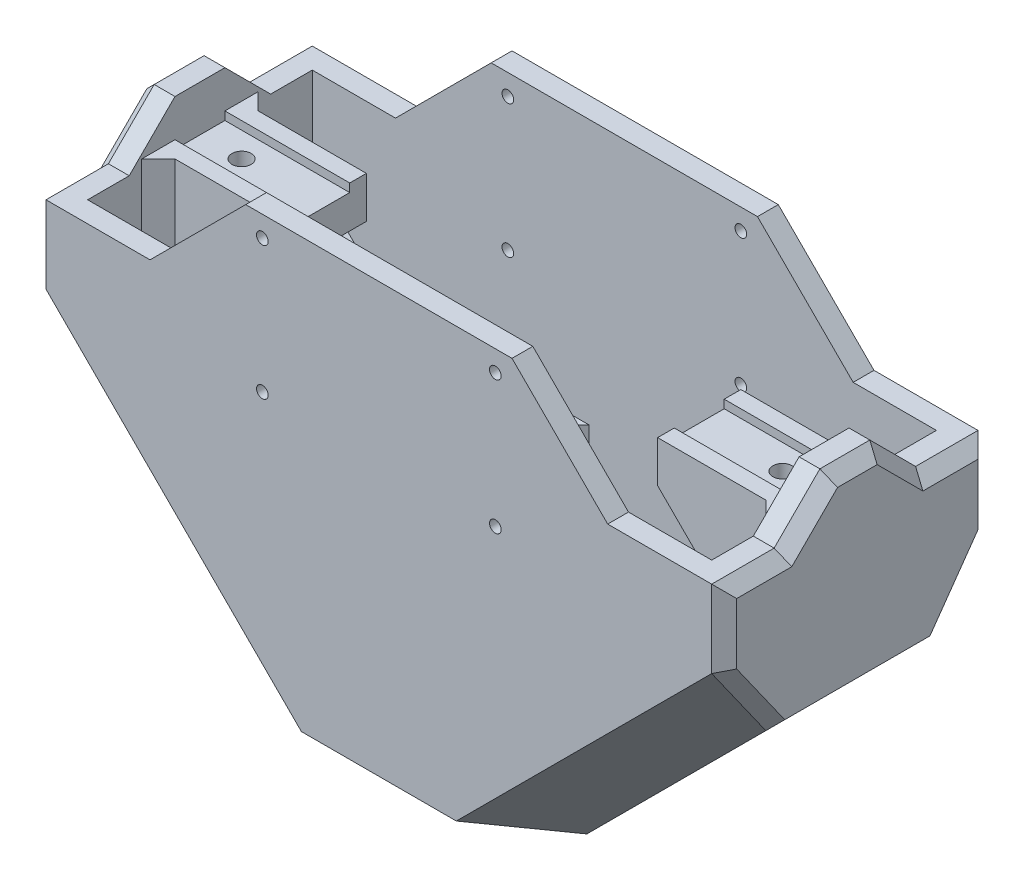
from build123d import *

# Parameters (mm, degrees)
SKETCH1_W                  = 150
SKETCH1_H                  = 54
BOSS_EXTRUDE1_DEPTH        = 75
SHELL1_T                   = 5
BOSS_EXTRUDE2_DEPTH        = 5
BOSS_EXTRUDE3_DEPTH        = 5
SKETCH3_R                  = 1.4
CUT_EXTRUDE1_DEPTH         = 6
BOSS_EXTRUDE4_DEPTH        = 10
SKETCH9_W                  = 30
SKETCH9_H                  = 20
BOSS_EXTRUDE6_DEPTH        = 2
CUT_EXTRUDE2_REACH         = 188.153
SKETCH10_W                 = 12
SKETCH10_H                 = 2
SKETCH11_R                 = 2.3
CUT_EXTRUDE3_DEPTH         = 6
SKETCH13_W                 = 10.5
SKETCH13_H                 = 15
BOSS_EXTRUDE8_DEPTH        = 27
BOSS_EXTRUDE9_DEPTH        = 3.2
CUT_EXTRUDE4_REACH         = 111.024
SKETCH15_R                 = 1.4
CHAMFER8_SIZE              = 0.5
CHAMFER8_OF_MIRROR6_SIZE   = 0.5
CHAMFER3_SIZE              = 40
CHAMFER5_SIZE              = 43
CHAMFER9_SIZE              = 5
CHAMFER10_SIZE             = 2
CHAMFER11_SIZE             = 10
CHAMFER12_SIZE             = 13
CHAMFER13_SIZE             = 4
BOSS_EXTRUDE10_DEPTH       = 3
CHAMFER14_SIZE             = 3
CHAMFER14_OF_MIRROR28_SIZE = 3


# Some blends are built 0.0001 mm under size
with BuildPart() as part:
    # Sketch1 → Boss-Extrude1 (new body)
    with BuildSketch(Plane(origin=(0, 0, 0), x_dir=(1, 0, 0), z_dir=(0, 1, 0))):
        Rectangle(SKETCH1_W, SKETCH1_H)
    extrude(amount=BOSS_EXTRUDE1_DEPTH)

    # Shell1
    shell1_openings = [part.faces().sort_by_distance(p)[0] for p in [
        (0, 75, 0),
    ]]
    offset(amount=SHELL1_T, openings=shell1_openings, kind=Kind.INTERSECTION)

    # Sketch2 → Boss-Extrude2 (add)
    with BuildSketch(Plane(origin=(80, 0, 0), x_dir=(0, 0, -1), z_dir=(1, 0, 0))):
        Polygon((-17, 75), (-6, 86), (6, 86), (17, 75), align=None)
    boss_extrude2 = extrude(amount=-BOSS_EXTRUDE2_DEPTH)

    # Sketch4 → Boss-Extrude3 (add)
    with BuildSketch(Plane(origin=(0, 0, -32), x_dir=(-1, 0, 0), z_dir=(0, 0, -1))):
        Polygon((-55, 75), (-32, 98), (32, 98), (55, 75), align=None)
    boss_extrude3 = extrude(amount=-BOSS_EXTRUDE3_DEPTH)

    # Sketch3 → Cut-Extrude1 (cut)
    with BuildSketch(Plane(origin=(0, 0, -32), x_dir=(-1, 0, 0), z_dir=(0, 0, -1))):
        with Locations((-28, 93)):
            Circle(SKETCH3_R)
        with Locations((-28, 61)):
            Circle(SKETCH3_R)
        with Locations((28, 93)):
            Circle(SKETCH3_R)
        with Locations((28, 61)):
            Circle(SKETCH3_R)
    cut_extrude1 = extrude(amount=-CUT_EXTRUDE1_DEPTH, mode=Mode.SUBTRACT)

    # Mirror4: Boss-Extrude3, Cut-Extrude1 across plane
    add(boss_extrude3.mirror(Plane.XY))
    add(cut_extrude1.mirror(Plane.XY), mode=Mode.SUBTRACT)

    # Mirror5: Boss-Extrude2 across plane
    add(boss_extrude2.mirror(Plane(origin=(0, 0, 0), x_dir=(0, 0, 1), z_dir=(1, 0, 0))))

    # Sketch5 → Boss-Extrude4 (add, symmetric)
    with BuildSketch(Plane.XY):
        Polygon((-75, 75), (-45, 75), (-45, 67), (-75, 37), align=None)
    boss_extrude4 = extrude(amount=BOSS_EXTRUDE4_DEPTH, both=True)

    # Sketch9 → Boss-Extrude6 (add)
    with BuildSketch(Plane(origin=(0, 75, 0), x_dir=(1, 0, 0), z_dir=(0, 1, 0))):
        with Locations((-60, 0)):
            Rectangle(SKETCH9_W, SKETCH9_H)
    boss_extrude6 = extrude(amount=BOSS_EXTRUDE6_DEPTH)

    # Sketch10 → Cut-Extrude2 (cut, up to next)
    with BuildSketch(Plane(origin=(-75, 0, 0), x_dir=(0, 0, -1), z_dir=(1, 0, 0)), mode=Mode.PRIVATE) as cut_extrude2_sk1:
        with Locations((0, 76)):
            Rectangle(SKETCH10_W, SKETCH10_H)
    cut_extrude2_tool1 = extrude(cut_extrude2_sk1.sketch, amount=CUT_EXTRUDE2_REACH, mode=Mode.PRIVATE) & part.part
    cut_extrude2 = cut_extrude2_tool1.solids().sort_by_distance((-75, 76, 0))[0]
    add(cut_extrude2, mode=Mode.SUBTRACT)

    # Sketch11 → Cut-Extrude3 (cut)
    with BuildSketch(Plane(origin=(0, 75, 0), x_dir=(1, 0, 0), z_dir=(0, 1, 0))):
        with Locations(Location((-65, 0, 0), (0, 0, 270))):
            Circle(SKETCH11_R)
    cut_extrude3 = extrude(amount=-CUT_EXTRUDE3_DEPTH, mode=Mode.SUBTRACT)

    # Mirror24: Boss-Extrude4, Boss-Extrude6, Cut-Extrude2, Cut-Extrude3 across plane
    add(boss_extrude4.mirror(Plane(origin=(0, 0, 0), x_dir=(0, 0, 1), z_dir=(1, 0, 0))))
    add(boss_extrude6.mirror(Plane(origin=(0, 0, 0), x_dir=(0, 0, 1), z_dir=(1, 0, 0))))
    add(cut_extrude2.mirror(Plane(origin=(0, 0, 0), x_dir=(0, 0, 1), z_dir=(1, 0, 0))), mode=Mode.SUBTRACT)
    add(cut_extrude3.mirror(Plane(origin=(0, 0, 0), x_dir=(0, 0, 1), z_dir=(1, 0, 0))), mode=Mode.SUBTRACT)

    # Sketch13 → Boss-Extrude8 (add, symmetric)
    with BuildSketch(Plane.XY):
        with Locations((35.75, 23.7)):
            Rectangle(SKETCH13_W, SKETCH13_H)
        with Locations((-15.75, 23.7)):
            Rectangle(SKETCH13_W, SKETCH13_H)
    extrude(amount=BOSS_EXTRUDE8_DEPTH, both=True)

    # Sketch14 → Boss-Extrude9 (add)
    with BuildSketch(Plane(origin=(0, 31.2, 0), x_dir=(1, 0, 0), z_dir=(0, 1, 0))):
        with BuildLine():
            Line((-10.5, -27), (-10.5, -9.6))
            Line((-10.5, -9.6), (-15.5, -9.6))
            ThreePointArc((-15.5, -9.6), (-16.914213562, -9.014213562), (-17.5, -7.6))
            Line((-17.5, -7.6), (-17.5, 7.6))
            ThreePointArc((-17.5, 7.6), (-16.914213562, 9.014213562), (-15.5, 9.6))
            Line((-15.5, 9.6), (-10.5, 9.6))
            Line((-10.5, 9.6), (-10.5, 27))
            Line((-10.5, 27), (-21, 27))
            Line((-21, 27), (-21, -27))
            Line((-21, -27), (-10.5, -27))
        make_face()
    boss_extrude9 = extrude(amount=BOSS_EXTRUDE9_DEPTH)

    # Sketch15 → Cut-Extrude4 (cut, up to next)
    with BuildSketch(Plane(origin=(0, 31.2, 0), x_dir=(1, 0, 0), z_dir=(0, 1, 0)), mode=Mode.PRIVATE) as cut_extrude4_sk1:
        with Locations(Location((-14.8, 5, 0), (0, 0, 180))):
            Circle(SKETCH15_R)
    cut_extrude4_tool1 = extrude(cut_extrude4_sk1.sketch, amount=-CUT_EXTRUDE4_REACH, mode=Mode.PRIVATE) & part.part
    # Sketch15 → Cut-Extrude4 (cut, up to next)
    with BuildSketch(Plane(origin=(0, 31.2, 0), x_dir=(1, 0, 0), z_dir=(0, 1, 0)), mode=Mode.PRIVATE) as cut_extrude4_sk2:
        with Locations(Location((-14.8, -5, 0), (0, 0, 180))):
            Circle(SKETCH15_R)
    cut_extrude4_tool2 = extrude(cut_extrude4_sk2.sketch, amount=-CUT_EXTRUDE4_REACH, mode=Mode.PRIVATE) & part.part
    cut_extrude4_1 = cut_extrude4_tool1.solids().sort_by_distance((-14.8, 31.2, -5))[0]
    add(cut_extrude4_1, mode=Mode.SUBTRACT)
    cut_extrude4_2 = cut_extrude4_tool2.solids().sort_by_distance((-14.8, 31.2, 5))[0]
    add(cut_extrude4_2, mode=Mode.SUBTRACT)
    cut_extrude4 = cut_extrude4_1 + cut_extrude4_2  # Cut-Extrude4 as one shape, for the pattern or mirror that repeats it

    # Chamfer8
    chamfer8_edges = [part.edges().sort_by_distance(p)[0] for p in [
        (-13.4, 31.2, -5),
        (-13.4, 31.2, 5),
    ]]
    chamfer(chamfer8_edges, length=CHAMFER8_SIZE)

    # Mirror6: Boss-Extrude9, Cut-Extrude4 across plane
    add(boss_extrude9.mirror(Plane(origin=(10, 0, 0), x_dir=(0, 0, 1), z_dir=(1, 0, 0))))
    add(cut_extrude4.mirror(Plane(origin=(10, 0, 0), x_dir=(0, 0, 1), z_dir=(1, 0, 0))), mode=Mode.SUBTRACT)

    # Chamfer8 of Mirror6
    chamfer8_of_mirror6_edges = [part.edges().sort_by_distance(p)[0] for p in [
        (33.4, 31.2, -5),
        (33.4, 31.2, 5),
    ]]
    chamfer(chamfer8_of_mirror6_edges, length=CHAMFER8_OF_MIRROR6_SIZE)

    # Chamfer3
    # the kernel refuses this chamfer: 40 mm, written as the material it adds along each edge
    with BuildSketch(Plane(origin=(75, 0, 27), x_dir=(0.027495876610586317, 0.9996219169112968, 0), z_dir=(0, 0, -1)), Plane(origin=(-75, 0, -27), x_dir=(-0.027495876610586317, 0.9996219169112968, 0), z_dir=(0, 0, 1))) as chamfer3_piece_1:
        Polygon((CHAMFER3_SIZE * 0.999621916911, -CHAMFER3_SIZE * 0.0274958766106), (-CHAMFER3_SIZE * 0.0274958766106, -CHAMFER3_SIZE * 0.999621916911), (0, 0), align=None)
    extrude(amount=54)

    # Chamfer5
    chamfer5_edges = [part.edges().sort_by_distance(p)[0] for p in [
        (-80, -5, 0),
        (80, -5, 0),
    ]]
    chamfer(chamfer5_edges, length=CHAMFER5_SIZE)

    # Chamfer9
    chamfer9_edges = [part.edges().sort_by_distance(p)[0] for p in [
        (35.75, 16.2, -27),
        (35.75, 16.2, 27),
        (-15.75, 16.2, -27),
        (-15.75, 16.2, 27),
    ]]
    chamfer(chamfer9_edges, length=CHAMFER9_SIZE)

    # Chamfer10
    chamfer10_edges = [part.edges().sort_by_distance(p)[0] for p in [
        (30.5, 22.8, -27),
        (41, 22.8, -27),
        (30.5, 22.8, 27),
        (41, 22.8, 27),
        (-10.5, 22.8, 27),
        (-21, 22.8, 27),
        (-10.5, 22.8, -27),
        (-21, 22.8, -27),
    ]]
    chamfer(chamfer10_edges, length=CHAMFER10_SIZE)

    # Chamfer11
    # the kernel refuses this chamfer: 10 mm, written as the material it adds along each edge
    with BuildSketch(Plane(origin=(93.184544799, 58.184544799, 27), x_dir=(-0.7068394360703909, 0.706839436070956, 0.027495876610586303), z_dir=(-0.7071067811868302, -0.7071067811862648, 0))) as chamfer11_piece_1_section:
        Polygon((CHAMFER11_SIZE * 0.999621916911, CHAMFER11_SIZE * 0.0274958766106), (-CHAMFER11_SIZE * 0.0274958766106, CHAMFER11_SIZE * 0.999621916911), (0, 0), align=None)
    chamfer11_piece_1 = extrude(amount=108.002202254, mode=Mode.PRIVATE)
    chamfer11_piece_1 = split(chamfer11_piece_1, bisect_by=Plane(origin=(75, 22.474171504, 23.809556955), z_dir=(-1, 0, 0)), keep=Keep.TOP, mode=Mode.PRIVATE)
    chamfer11_piece_1 = split(chamfer11_piece_1, bisect_by=Plane(origin=(52.525828496, 0, 23.809556955), z_dir=(0, 1, 0)), keep=Keep.TOP, mode=Mode.PRIVATE)
    add(chamfer11_piece_1)
    with BuildSketch(Plane(origin=(93.184544799, 58.184544799, -27), x_dir=(-0.7068394360703909, 0.7068394360709561, -0.027495876610586348), z_dir=(-0.7071067811868302, -0.7071067811862648, 0))) as chamfer11_piece_2_section:
        Polygon((CHAMFER11_SIZE * 0.999621916911, -CHAMFER11_SIZE * 0.0274958766106), (-CHAMFER11_SIZE * 0.0274958766106, -CHAMFER11_SIZE * 0.999621916911), (0, 0), align=None)
    chamfer11_piece_2 = extrude(amount=108.002202254, mode=Mode.PRIVATE)
    chamfer11_piece_2 = split(chamfer11_piece_2, bisect_by=Plane(origin=(75, 22.474171504, -23.809556955), z_dir=(-1, 0, 0)), keep=Keep.TOP, mode=Mode.PRIVATE)
    chamfer11_piece_2 = split(chamfer11_piece_2, bisect_by=Plane(origin=(52.525828496, 0, -23.809556955), z_dir=(0, 1, 0)), keep=Keep.TOP, mode=Mode.PRIVATE)
    add(chamfer11_piece_2)
    with BuildSketch(Plane(origin=(-93.184544799, 58.184544799, -27), x_dir=(0.7068394360703909, 0.706839436070956, -0.027495876610586303), z_dir=(0.7071067811868302, -0.7071067811862648, 0))) as chamfer11_piece_3_section:
        Polygon((CHAMFER11_SIZE * 0.999621916911, CHAMFER11_SIZE * 0.0274958766106), (-CHAMFER11_SIZE * 0.0274958766106, CHAMFER11_SIZE * 0.999621916911), (0, 0), align=None)
    chamfer11_piece_3 = extrude(amount=108.002202254, mode=Mode.PRIVATE)
    chamfer11_piece_3 = split(chamfer11_piece_3, bisect_by=Plane(origin=(-75, 22.474171504, -23.809556955), z_dir=(1, 0, 0)), keep=Keep.TOP, mode=Mode.PRIVATE)
    chamfer11_piece_3 = split(chamfer11_piece_3, bisect_by=Plane(origin=(-52.525828496, 0, -23.809556955), z_dir=(0, 1, 0)), keep=Keep.TOP, mode=Mode.PRIVATE)
    add(chamfer11_piece_3)
    with BuildSketch(Plane(origin=(-93.184544799, 58.184544799, 27), x_dir=(0.7068394360703909, 0.7068394360709561, 0.027495876610586334), z_dir=(0.7071067811868302, -0.7071067811862648, 0))) as chamfer11_piece_4_section:
        Polygon((CHAMFER11_SIZE * 0.999621916911, -CHAMFER11_SIZE * 0.0274958766106), (-CHAMFER11_SIZE * 0.0274958766106, -CHAMFER11_SIZE * 0.999621916911), (0, 0), align=None)
    chamfer11_piece_4 = extrude(amount=108.002202254, mode=Mode.PRIVATE)
    chamfer11_piece_4 = split(chamfer11_piece_4, bisect_by=Plane(origin=(-75, 22.474171504, 23.809556955), z_dir=(1, 0, 0)), keep=Keep.TOP, mode=Mode.PRIVATE)
    chamfer11_piece_4 = split(chamfer11_piece_4, bisect_by=Plane(origin=(-52.525828496, 0, 23.809556955), z_dir=(0, 1, 0)), keep=Keep.TOP, mode=Mode.PRIVATE)
    add(chamfer11_piece_4)

    # Chamfer12
    chamfer12_edges = [part.edges().sort_by_distance(p)[0] for p in [
        (-58.5, 16.5, -32),
        (58.5, 16.5, -32),
        (-58.5, 16.5, 32),
        (58.5, 16.5, 32),
    ]]
    chamfer(chamfer12_edges, length=CHAMFER12_SIZE)

    # Chamfer13
    # the kernel refuses this chamfer: 4 mm, written as the material it adds along each edge
    with BuildSketch(Plane(origin=(-75, 29.713268048, 10), x_dir=(-0.027495876610585623, 0, 0.9996219169112968), z_dir=(0, 1, 0))) as chamfer13_piece_1_section:
        Polygon((CHAMFER13_SIZE * 0.999621916911, CHAMFER13_SIZE * 0.0274958766106), (-CHAMFER13_SIZE * 0.0274958766106, CHAMFER13_SIZE * 0.999621916911), (0, 0), align=None)
    chamfer13_piece_1 = extrude(amount=47.286731952, mode=Mode.PRIVATE)
    chamfer13_piece_1 = split(chamfer13_piece_1, bisect_by=Plane(origin=(-63.755995162, 48.244004838, 11.33377678), z_dir=(-0.7071067811865515, 0.7071067811865436, 0)), keep=Keep.TOP, mode=Mode.PRIVATE)
    add(chamfer13_piece_1)
    with BuildSketch(Plane(origin=(-75, 77, -10), x_dir=(-0.027495876610737532, 0, -0.9996219169112927), z_dir=(0, -1, 0))) as chamfer13_piece_2_section:
        Polygon((CHAMFER13_SIZE * 0.999621916911, CHAMFER13_SIZE * 0.0274958766106), (-CHAMFER13_SIZE * 0.0274958766107, CHAMFER13_SIZE * 0.999621916911), (0, 0), align=None)
    chamfer13_piece_2 = extrude(amount=47.286731952, mode=Mode.PRIVATE)
    chamfer13_piece_2 = split(chamfer13_piece_2, bisect_by=Plane(origin=(-63.755995162, 48.244004838, -11.33377678), z_dir=(-0.7071067811865515, 0.7071067811865436, 0)), keep=Keep.TOP, mode=Mode.PRIVATE)
    add(chamfer13_piece_2)
    with BuildSketch(Plane(origin=(75, 77, 10), x_dir=(0.02749587661043717, 0, 0.9996219169113009), z_dir=(0, -1, 0))) as chamfer13_piece_3_section:
        Polygon((CHAMFER13_SIZE * 0.999621916911, CHAMFER13_SIZE * 0.0274958766106), (-CHAMFER13_SIZE * 0.0274958766104, CHAMFER13_SIZE * 0.999621916911), (0, 0), align=None)
    chamfer13_piece_3 = extrude(amount=47.286731952, mode=Mode.PRIVATE)
    chamfer13_piece_3 = split(chamfer13_piece_3, bisect_by=Plane(origin=(63.755995162, 48.244004838, 11.33377678), z_dir=(0.7071067811865515, 0.7071067811865436, 0)), keep=Keep.TOP, mode=Mode.PRIVATE)
    add(chamfer13_piece_3)
    with BuildSketch(Plane(origin=(75, 29.713268048, -10), x_dir=(0.027495876610585623, 0, -0.9996219169112968), z_dir=(0, 1, 0))) as chamfer13_piece_4_section:
        Polygon((CHAMFER13_SIZE * 0.999621916911, CHAMFER13_SIZE * 0.0274958766106), (-CHAMFER13_SIZE * 0.0274958766106, CHAMFER13_SIZE * 0.999621916911), (0, 0), align=None)
    chamfer13_piece_4 = extrude(amount=47.286731952, mode=Mode.PRIVATE)
    chamfer13_piece_4 = split(chamfer13_piece_4, bisect_by=Plane(origin=(63.755995162, 48.244004838, -11.33377678), z_dir=(0.7071067811865515, 0.7071067811865436, 0)), keep=Keep.TOP, mode=Mode.PRIVATE)
    add(chamfer13_piece_4)

    # Sketch16 → Boss-Extrude10 (add)
    with BuildSketch(Plane(origin=(80, 0, 0), x_dir=(0, 0, -1), z_dir=(1, 0, 0))):
        Polygon((-19, 38), (19, 38), (32, 56.384776311), (32, 75), (17, 75), (6, 86), (-6, 86), (-17, 75), (-32, 75), (-32, 56.384776311), align=None)
    boss_extrude10 = extrude(amount=BOSS_EXTRUDE10_DEPTH)

    # Chamfer14
    chamfer14_edges = [part.edges().sort_by_distance(p)[0] for p in [
        (83, 65.692388155, 32),
        (83, 75, 24.5),
        (83, 80.5, 11.5),
        (83, 86, 0),
        (83, 80.5, -11.5),
        (83, 75, -24.5),
        (83, 65.692388155, -32),
        (83, 47.192388155, -25.5),
        (83, 38, 0),
        (83, 47.192388155, 25.5),
    ]]
    chamfer(chamfer14_edges, length=CHAMFER14_SIZE - 0.0001)  # a hair under: the kernel refuses the full size

    # Mirror28: Boss-Extrude10 across plane
    add(boss_extrude10.mirror(Plane(origin=(0, 0, 0), x_dir=(0, 0, 1), z_dir=(1, 0, 0))))

    # Chamfer14 of Mirror28
    chamfer14_of_mirror28_edges = [part.edges().sort_by_distance(p)[0] for p in [
        (-83, 65.692388155, 32),
        (-83, 75, 24.5),
        (-83, 80.5, 11.5),
        (-83, 86, 0),
        (-83, 80.5, -11.5),
        (-83, 75, -24.5),
        (-83, 65.692388155, -32),
        (-83, 47.192388155, -25.5),
        (-83, 38, 0),
        (-83, 47.192388155, 25.5),
    ]]
    chamfer(chamfer14_of_mirror28_edges, length=CHAMFER14_OF_MIRROR28_SIZE - 0.0001)  # a hair under: the kernel refuses the full size


solid = part.part
